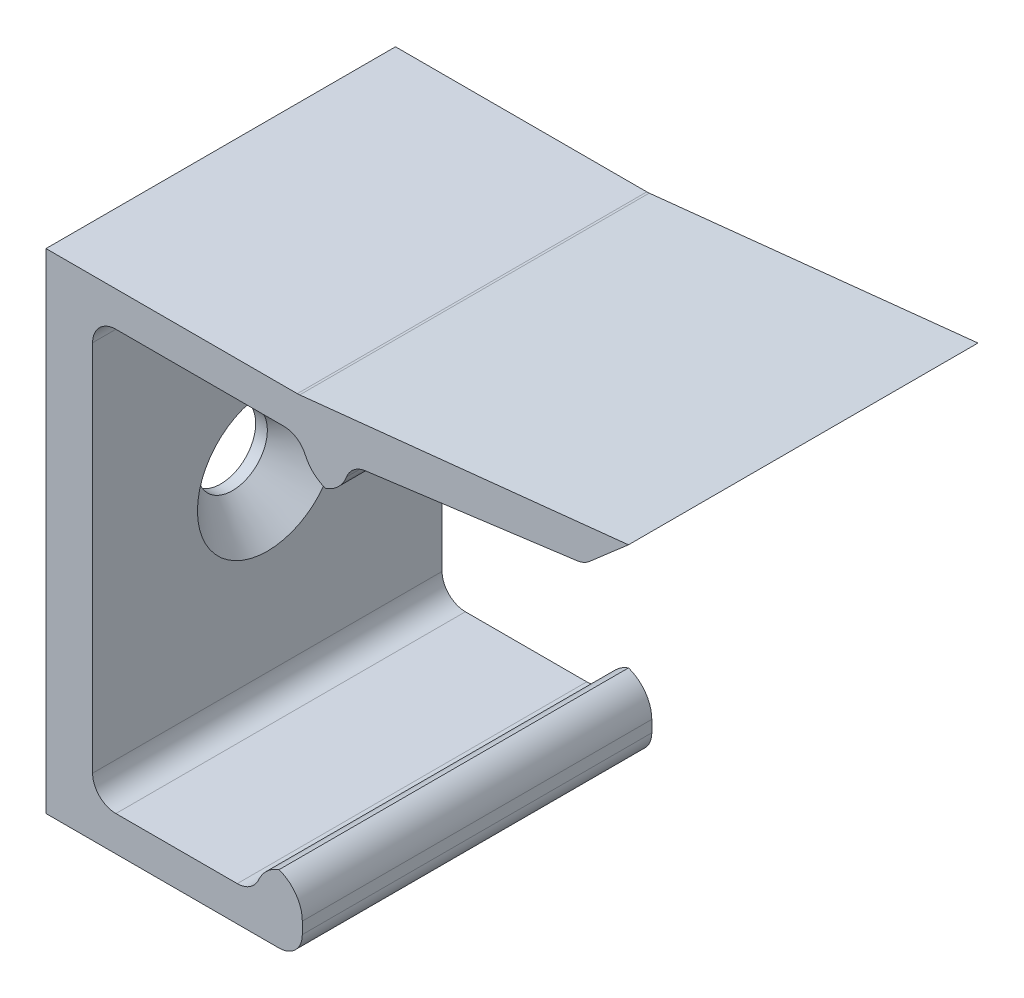
from build123d import *

# Parameters (mm, degrees)
BOSS_EXTRUDE1_DEPTH     = 15
CUT_EXTRUDE1_DEPTH      = 36.492719011
CUT_EXTRUDE1_DEPTH_BACK = 36.492719011
SKETCH2_R               = 1.5
CHAMFER1_SIZE           = 1.5
FILLET1_R               = 1.5
FILLET2_R               = 1
FILLET3_R               = 1


with BuildPart() as part:
    # Sketch1 → Boss-Extrude1 (new body)
    with BuildSketch(Plane.XY):
        Polygon((0, 0), (11, 0), (11, 3), (9, 3), (9, 1.5), (2, 1.5), (2, 19.5), (11, 19.5), (11, 18), (13, 18), (13, 19.5), (23.094875358, 20.832410877), (25, 22.488510462), (10.837768967, 21), (0, 21), align=None)
    extrude(amount=BOSS_EXTRUDE1_DEPTH)

    # Sketch2 → Cut-Extrude1 (cut, two sides: drawn at the far end of the back side and taken through both)
    with BuildSketch(Plane(origin=(2, 0, 0), x_dir=(0, 0, -1), z_dir=(1, 0, 0)).offset(-CUT_EXTRUDE1_DEPTH_BACK)):
        with Locations(Location((-7.5, 10, 0), (0, 0, 90))):
            Circle(SKETCH2_R)
    extrude(amount=CUT_EXTRUDE1_DEPTH + CUT_EXTRUDE1_DEPTH_BACK, mode=Mode.SUBTRACT)

    # Chamfer1
    chamfer1_edges = [part.edges().sort_by_distance(p)[0] for p in [
        (2, 8.5, 7.5),
    ]]
    chamfer(chamfer1_edges, length=CHAMFER1_SIZE)

    # Fillet1
    # the kernel refuses this fillet: 1.5 mm, written as the material it takes off along each edge
    with BuildSketch(Plane(origin=(9, 3, -3.75), x_dir=(1, 0, 0), z_dir=(0, 0, 1)), Plane(origin=(11, 3, -3.75), x_dir=(0, -1, 0), z_dir=(0, 0, 1)), Plane(origin=(13, 18, -3.75), x_dir=(-1, 0, 0), z_dir=(0, 0, 1)), Plane(origin=(11, 18, -3.75), x_dir=(0, 1, 0), z_dir=(0, 0, 1))) as fillet1_piece_1:
        with BuildLine():
            CenterArc((FILLET1_R, -FILLET1_R), FILLET1_R, 90, 90)
            Line((0, -FILLET1_R), (0, 0))
            Line((0, 0), (FILLET1_R, 0))
        make_face()
    extrude(amount=22.5, mode=Mode.SUBTRACT)

    # Fillet2
    fillet2_edges = [part.edges().sort_by_distance(p)[0] for p in [
        (2, 1.5, 7.5),
        (11, 0, 7.5),
        (10.837768967, 21, 7.5),
        (23.094875358, 20.832410877, 7.5),
        (2, 19.5, 7.5),
    ]]
    fillet(fillet2_edges, radius=FILLET2_R)

    # Fillet3
    fillet3_edges = [part.edges().sort_by_distance(p)[0] for p in [
        (9, 1.5, 7.5),
        (13, 19.5, 7.5),
        (11, 19.5, 7.5),
    ]]
    fillet(fillet3_edges, radius=FILLET3_R)


solid = part.part
